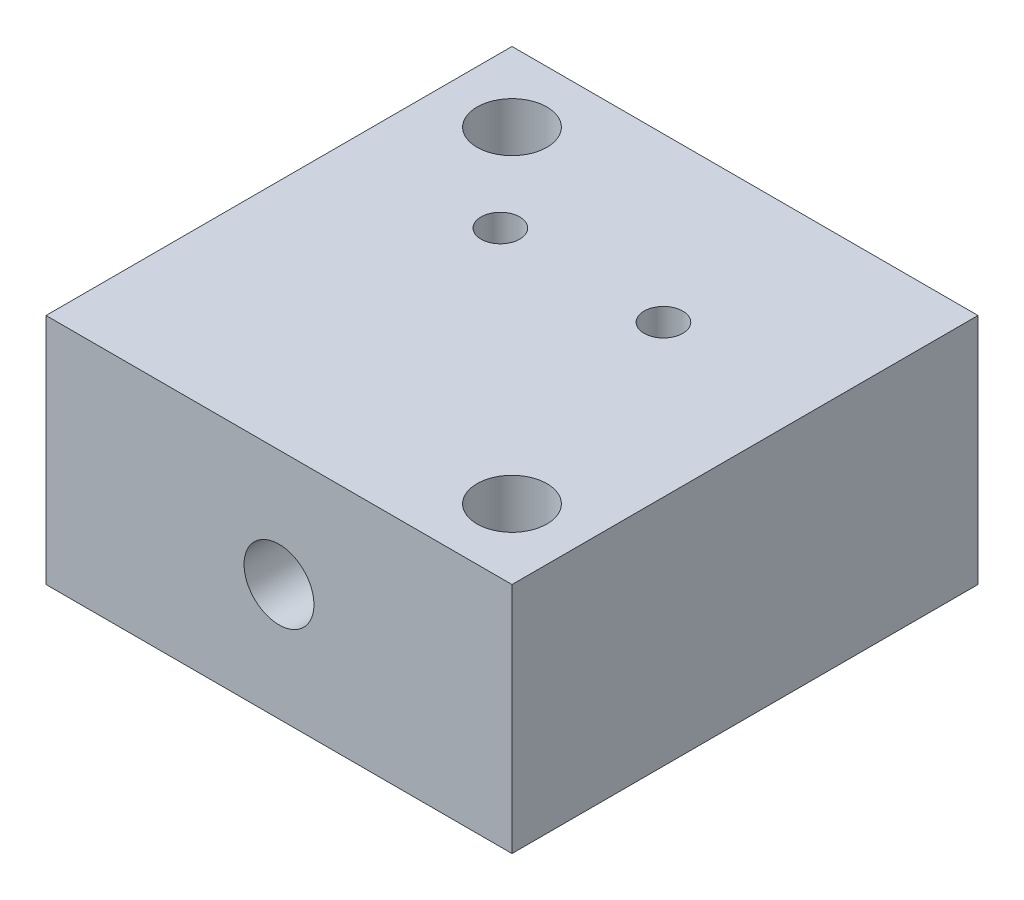
from build123d import *

# Parameters (mm, degrees)
SKIZZE1_W                                           = 100
SKIZZE1_H                                           = 50
AUFSATZ_LINEAR_AUSTRAGEN1_DEPTH                     = 100
STIRNSENKUNG_F_R_M8_SENKSCHRAUBE_KOPF_B_D           = 9
STIRNSENKUNG_F_R_M8_SENKSCHRAUBE_KOPF_B_CBORE_D     = 15
STIRNSENKUNG_F_R_M8_SENKSCHRAUBE_KOPF_B_CBORE_DEPTH = 45
STIRNSENKUNG_F_R_M8_SENKSCHRAUBE_KO_2_D             = 9
STIRNSENKUNG_F_R_M8_SENKSCHRAUBE_KO_2_CBORE_D       = 15
STIRNSENKUNG_F_R_M8_SENKSCHRAUBE_KO_2_CBORE_DEPTH   = 116


# Read off the part's stored shape, not the designer's step: Kernloch für M8 Helicoil1
with BuildPart() as part:
    # Skizze1 → Aufsatz-Linear austragen1 (new body)
    with BuildSketch(Plane.XY):
        Rectangle(SKIZZE1_W, SKIZZE1_H)
    extrude(amount=AUFSATZ_LINEAR_AUSTRAGEN1_DEPTH)

    # Stirnsenkung f_r M8 Senkschraube _Kopf B (through all)
    with Locations(Plane(origin=(0, 25, 0), x_dir=(1, 0, 0), z_dir=(0, 1, 0))):
        with Locations((35, -85), (-35, -15)):
            CounterBoreHole(STIRNSENKUNG_F_R_M8_SENKSCHRAUBE_KOPF_B_D / 2, STIRNSENKUNG_F_R_M8_SENKSCHRAUBE_KOPF_B_CBORE_D / 2, STIRNSENKUNG_F_R_M8_SENKSCHRAUBE_KOPF_B_CBORE_DEPTH)

    # Stirnsenkung f_r M8 Senkschraube _Ko 2 (through all)
    with Locations(Plane.XY.offset(100)):
        with Locations((0, 0)):
            CounterBoreHole(STIRNSENKUNG_F_R_M8_SENKSCHRAUBE_KO_2_D / 2, STIRNSENKUNG_F_R_M8_SENKSCHRAUBE_KO_2_CBORE_D / 2, STIRNSENKUNG_F_R_M8_SENKSCHRAUBE_KO_2_CBORE_DEPTH)

    # Kernloch für M8 Helicoil1 outline → Kernloch für M8 Helicoil1 (revolve, cut)
    with BuildSketch(Plane(origin=(17.5, 0, 35), x_dir=(1, 0, 0), z_dir=(0, 0, 1))):
        Polygon((0, 25), (0, 2.506428431), (4.15, 5), (4.15, 25), align=None)
    revolve(axis=Axis((17.5, 0, 35), (0, 1, 0)), mode=Mode.SUBTRACT)

    # Kernloch f_r M8 Helicoil1 2 outline → Kernloch f_r M8 Helicoil1 2 (revolve, cut)
    with BuildSketch(Plane(origin=(-17.5, 0, 35), x_dir=(1, 0, 0), z_dir=(0, 0, 1))):
        Polygon((0, 25), (0, 2.506428431), (4.15, 5), (4.15, 25), align=None)
    revolve(axis=Axis((-17.5, 0, 35), (0, 1, 0)), mode=Mode.SUBTRACT)


solid = part.part
